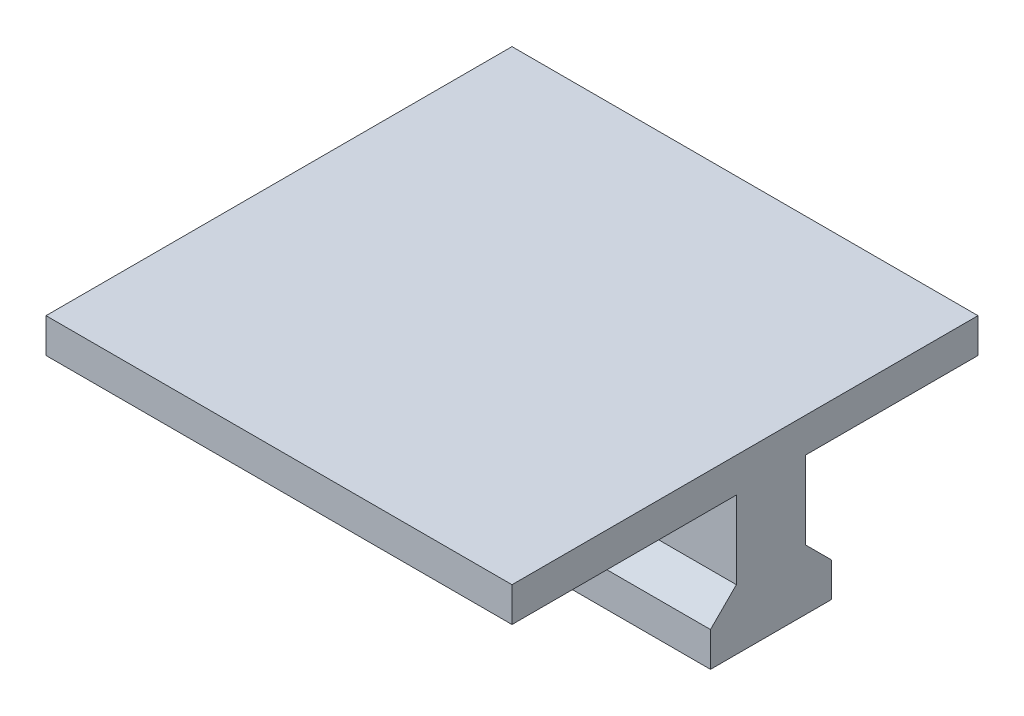
from build123d import *

# Parameters (mm, degrees)
SKETCH1_W           = 27
SKETCH1_H           = 27
BOSS_EXTRUDE1_DEPTH = 2
SKETCH2_W           = 27
SKETCH2_H           = 4
BOSS_EXTRUDE2_DEPTH = 8
SKETCH3_W           = 27
SKETCH3_H           = 7
BOSS_EXTRUDE3_DEPTH = 2
CHAMFER1_SIZE       = 1.5


with BuildPart() as part:
    # Sketch1 → Boss-Extrude1 (new body)
    with BuildSketch(Plane(origin=(0, 0, 0), x_dir=(1, 0, 0), z_dir=(0, 1, 0))):
        Rectangle(SKETCH1_W, SKETCH1_H)
    extrude(amount=BOSS_EXTRUDE1_DEPTH)

    # Sketch2 → Boss-Extrude2 (add)
    with BuildSketch(Plane.XZ):
        with Locations((0, -1.5)):
            Rectangle(SKETCH2_W, SKETCH2_H)
    extrude(amount=BOSS_EXTRUDE2_DEPTH)

    # Sketch3 → Boss-Extrude3 (add)
    with BuildSketch(Plane.XZ.offset(8)):
        with Locations((0, -1.5)):
            Rectangle(SKETCH3_W, SKETCH3_H)
    extrude(amount=-BOSS_EXTRUDE3_DEPTH)

    # Chamfer1
    chamfer1_edges = [part.edges().sort_by_distance(p)[0] for p in [
        (0, -6, -3.5),
        (0, -6, 0.5),
    ]]
    chamfer(chamfer1_edges, length=CHAMFER1_SIZE - 0.0001)  # a hair under: the kernel refuses the full size


solid = part.part
